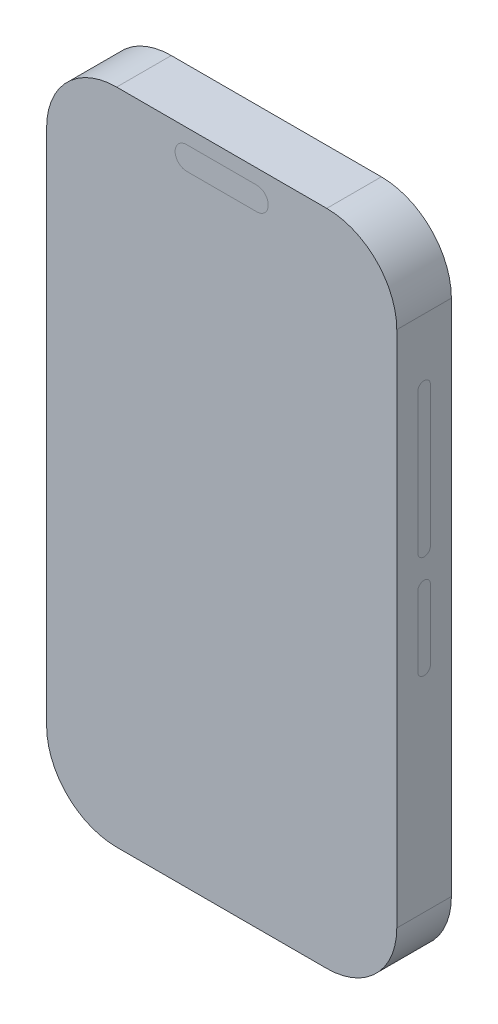
from build123d import *

# Parameters (mm, degrees)
EXTRUDE_1_DEPTH = 7.8


with BuildPart() as part:
    # 草图2 → 凸台-拉伸1 (new body)
    with BuildSketch(Plane.XY):
        with BuildLine():
            Line((-15, 47), (15, 47))
            ThreePointArc((15, 47), (22.071067812, 44.071067812), (25, 37))
            Line((25, 37), (25, -37))
            ThreePointArc((25, -37), (22.071067812, -44.071067812), (15, -47))
            Line((15, -47), (-15, -47))
            ThreePointArc((-15, -47), (-22.071067812, -44.071067812), (-25, -37))
            Line((-25, -37), (-25, 37))
            ThreePointArc((-25, 37), (-22.071067812, 44.071067812), (-15, 47))
        make_face()
    extrude(amount=EXTRUDE_1_DEPTH)


solid = part.part
